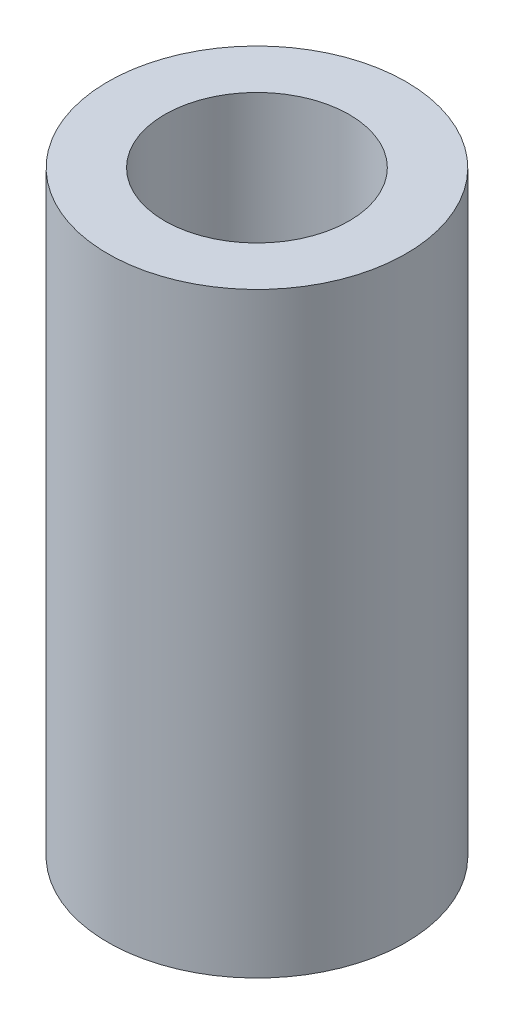
from build123d import *

# Parameters (mm, degrees)
SKETCH1_R           = 2.38125
SKETCH1_R_2         = 1.4732
BOSS_EXTRUDE1_DEPTH = 9.525


with BuildPart() as part:
    # Sketch1 → Boss-Extrude1 (new body)
    with BuildSketch(Plane(origin=(0, 0, 0), x_dir=(1, 0, 0), z_dir=(0, 1, 0))):
        Circle(SKETCH1_R)
        Circle(SKETCH1_R_2, mode=Mode.SUBTRACT)
    extrude(amount=BOSS_EXTRUDE1_DEPTH)


solid = part.part
